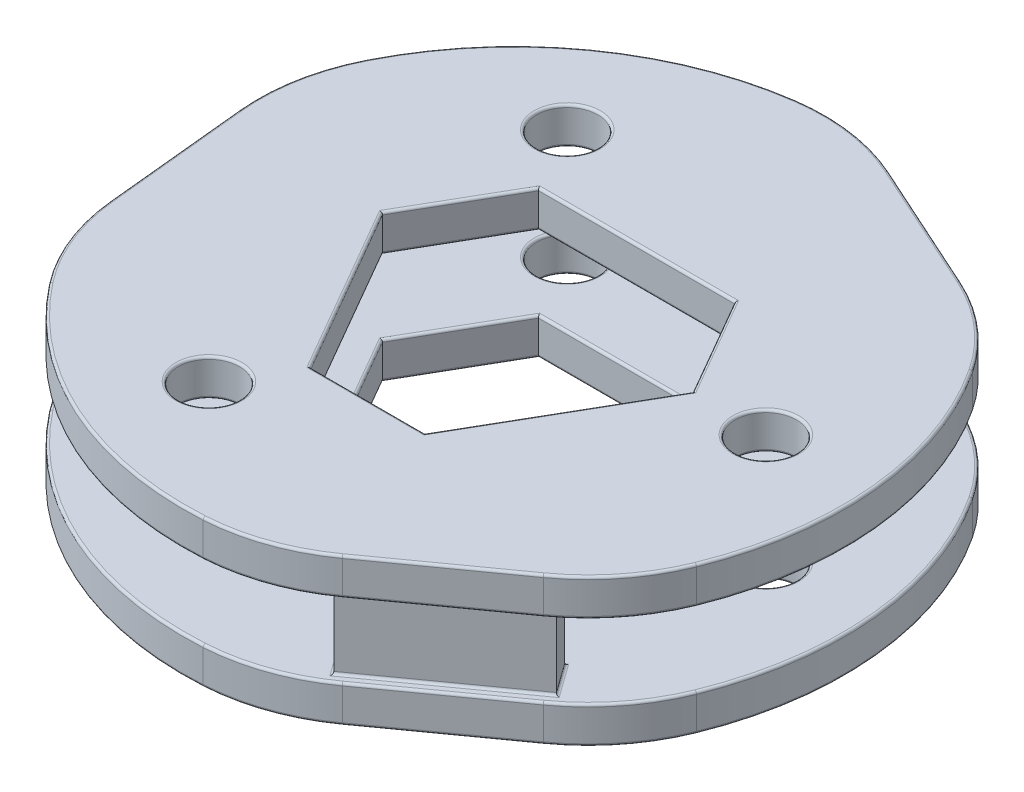
from build123d import *

# Parameters (mm, degrees)
SKETCH1_W                = 135
SKETCH1_H                = 15
SKETCH2_R                = 12.5
BOSS_EXTRUDE1_DEPTH      = 30
CIRPATTERN1_COUNT        = 3
CUT_EXTRUDE1_DEPTH       = 201.124960962
BOSS_EXTRUDE2_DEPTH      = 45
CUT_EXTRUDE2_DEPTH       = 201.124960962
FILLET1_R                = 80
CIRPATTERN2_COUNT        = 3
FILLET1_OF_CIRPATTERN2_R = 80
SPLIT2_START             = 15
SPLIT2_DEPTH             = 30
SPLIT2_2_DEPTH           = 30
SPLIT2_3_DEPTH           = 30
SPLIT2_4_OUTLINE_R       = 12.5
SPLIT2_4_DEPTH           = 30
SPLIT2_5_OUTLINE_R       = 12.5
SPLIT2_5_DEPTH           = 30
SPLIT2_6_OUTLINE_R       = 12.5
SPLIT2_6_DEPTH           = 30
SPLIT2_7_OUTLINE_R       = 12.5
SPLIT2_7_DEPTH           = 30
SKETCH8_R                = 12.5
CUT_EXTRUDE3_DEPTH       = 201.124960962
CIRPATTERN3_COUNT        = 3
FILLET3_R                = 1


# Read off the part's stored shape, not the designer's step: Split1, Split2
with BuildPart() as part:
    # Sketch1 → Revolve1 (revolve)
    with BuildSketch(Plane.XY, mode=Mode.PRIVATE) as revolve1_sk:
        with Locations((67.5, 7.5)):
            Rectangle(SKETCH1_W, SKETCH1_H)
    revolve1 = revolve(revolve1_sk.sketch.rotate(Axis((0, 15, 0), (0, -1, 0)), 90), axis=Axis((0, 15, 0), (0, -1, 0)))

    # Sketch2 → Boss-Extrude1 (add)
    with BuildSketch(Plane(origin=(0, 15, 0), x_dir=(1, 0, 0), z_dir=(0, 1, 0))):
        with Locations(Location((94, 9.213459812, 0), (0, 0, 90))):
            Circle(SKETCH2_R)
    boss_extrude1 = extrude(amount=BOSS_EXTRUDE1_DEPTH)

    # CirPattern1: Boss-Extrude1 ×3 about axis
    cirpattern1_axis = Axis((0, 0, 0), (0, 1, 0))
    for i in range(1, CIRPATTERN1_COUNT):
        add(boss_extrude1.rotate(cirpattern1_axis, i * 360 / CIRPATTERN1_COUNT))

    # Mirror1: Revolve1 across plane
    add(revolve1.mirror(Plane.ZX.offset(30)))

    # Sketch3 → Cut-Extrude1 (cut, through all)
    with BuildSketch(Plane(origin=(0, 60, 0), x_dir=(1, 0, 0), z_dir=(0, 1, 0))):
        Polygon((-40, 50), (40, 50), (63.301270189, 9.641016151), (23.301270189, -59.641016151), (-23.301270189, -59.641016151), (-63.301270189, 9.641016151), align=None)
    extrude(amount=-CUT_EXTRUDE1_DEPTH, mode=Mode.SUBTRACT)

    # Sketch4 → Boss-Extrude2 (add)
    with BuildSketch(Plane(origin=(0, 60, 0), x_dir=(1, 0, 0), z_dir=(0, 1, 0))):
        Polygon((-110.1811428, 21.739727949), (-125.108017737, 20.260402217), (-118.697606231, -44.422722509), (-103.770731294, -42.943396777), align=None)
    boss_extrude2 = extrude(amount=-BOSS_EXTRUDE2_DEPTH)

    # Sketch5 → Cut-Extrude2 (cut, through all)
    with BuildSketch(Plane(origin=(0, 60, 0), x_dir=(1, 0, 0), z_dir=(0, 1, 0))):
        Polygon((-131.511500416, 44.31459416), (-119.441522169, -77.475388847), (-152.060350872, -80.524763143), (-164.112338914, 41.083692884), align=None)
    cut_extrude2 = extrude(amount=-CUT_EXTRUDE2_DEPTH, mode=Mode.SUBTRACT)

    # Fillet1
    fillet1_edges = [part.edges().sort_by_distance(p)[0] for p in [
        (-130.532936264, 7.5, -34.440565477),
        (-121.23368767, 7.5, 59.391859492),
        (-121.23368767, 52.5, 59.391859492),
        (-130.532936264, 52.5, -34.440565477),
    ]]
    fillet(fillet1_edges, radius=FILLET1_R)

    # CirPattern2: Boss-Extrude2, Cut-Extrude2 ×3 about axis
    cirpattern2_axis = Axis((0, 0, 0), (0, 1, 0))
    add([boss_extrude2.rotate(cirpattern2_axis, i * 360 / CIRPATTERN2_COUNT) for i in range(1, CIRPATTERN2_COUNT)])
    add([cut_extrude2.rotate(cirpattern2_axis, i * 360 / CIRPATTERN2_COUNT) for i in range(1, CIRPATTERN2_COUNT)], mode=Mode.SUBTRACT)

    # Fillet1 of CirPattern2
    fillet1_of_cirpattern2_edges = [part.edges().sort_by_distance(p)[0] for p in [
        (35.440063508, 7.5, 130.265121573),
        (112.051702933, 7.5, 75.29552357),
        (112.051702933, 52.5, 75.29552357),
        (35.440063508, 52.5, 130.265121573),
        (95.092872755, 7.5, -95.824556097),
        (9.181984737, 7.5, -134.687383063),
        (9.181984737, 52.5, -134.687383063),
        (95.092872755, 52.5, -95.824556097),
    ]]
    fillet(fillet1_of_cirpattern2_edges, radius=FILLET1_OF_CIRPATTERN2_R)


with BuildPart() as body_2:
    # Split1: the piece on the far side of the plane
    add(part.part)
    split(bisect_by=Plane(origin=(0, 15, 0), x_dir=(1, 0, 0), z_dir=(0, 1, 0)), keep=Keep.BOTTOM)


with BuildPart() as part_1:
    add(part.part)

    # Split1
    split(bisect_by=Plane(origin=(0, 15, 0), x_dir=(1, 0, 0), z_dir=(0, 1, 0)), keep=Keep.TOP)

    # Split2 4 outline → Split2 4 (cut)
    with BuildSketch(Plane(origin=(0, 0, 0), x_dir=(1, 0, 0), z_dir=(0, 1, 0)).offset(SPLIT2_START)):
        with Locations((94, 9.213459812)):
            Circle(SPLIT2_4_OUTLINE_R)
        with Locations((-54.979090254, 76.79965805)):
            Circle(SPLIT2_4_OUTLINE_R)
        with Locations((-39.020909746, -86.013117862)):
            Circle(SPLIT2_4_OUTLINE_R)
        Polygon((-110.1811428, 21.739727949), (-125.108017737, 20.260402217), (-118.697606231, -44.422722509), (-103.770731294, -42.943396777), align=None)
        Polygon((73.917728075, 84.549804708), (80.100031879, 98.216520469), (20.877596917, 125.006503619), (14.695293113, 111.339787858), align=None)
        Polygon((36.263414725, -106.289532657), (45.007985857, -118.476922686), (97.820009313, -80.58378111), (89.07543818, -68.396391081), align=None)
    extrude(amount=SPLIT2_4_DEPTH, mode=Mode.SUBTRACT)


with BuildPart() as body_3:
    # Split2 outline → Split2 (new body)
    with BuildSketch(Plane(origin=(0, 0, 0), x_dir=(1, 0, 0), z_dir=(0, 1, 0)).offset(SPLIT2_START)):
        Polygon((20.877596917, 125.006503619), (14.695293113, 111.339787858), (73.917728075, 84.549804708), (80.100031879, 98.216520469), align=None)
    extrude(amount=SPLIT2_DEPTH)


with BuildPart() as body_4:
    # Split2 2 outline → Split2 2 (new body)
    with BuildSketch(Plane(origin=(0, 0, 0), x_dir=(1, 0, 0), z_dir=(0, 1, 0)).offset(SPLIT2_START)):
        Polygon((-118.697606231, -44.422722509), (-103.770731294, -42.943396777), (-110.1811428, 21.739727949), (-125.108017737, 20.260402217), align=None)
    extrude(amount=SPLIT2_2_DEPTH)


with BuildPart() as body_5:
    # Split2 3 outline → Split2 3 (new body)
    with BuildSketch(Plane(origin=(0, 0, 0), x_dir=(1, 0, 0), z_dir=(0, 1, 0)).offset(SPLIT2_START)):
        Polygon((97.820009313, -80.58378111), (89.07543818, -68.396391081), (36.263414725, -106.289532657), (45.007985857, -118.476922686), align=None)
    extrude(amount=SPLIT2_3_DEPTH)


with BuildPart() as body_6:
    # Split2 5 outline → Split2 5 (new body)
    with BuildSketch(Plane(origin=(0, 0, 0), x_dir=(1, 0, 0), z_dir=(0, 1, 0)).offset(SPLIT2_START)):
        with Locations((94, 9.213459812)):
            Circle(SPLIT2_5_OUTLINE_R)
    extrude(amount=SPLIT2_5_DEPTH)


with BuildPart() as body_7:
    # Split2 6 outline → Split2 6 (new body)
    with BuildSketch(Plane(origin=(0, 0, 0), x_dir=(1, 0, 0), z_dir=(0, 1, 0)).offset(SPLIT2_START)):
        with Locations((-54.979090254, 76.79965805)):
            Circle(SPLIT2_6_OUTLINE_R)
    extrude(amount=SPLIT2_6_DEPTH)


with BuildPart() as body_8:
    # Split2 7 outline → Split2 7 (new body)
    with BuildSketch(Plane(origin=(0, 0, 0), x_dir=(1, 0, 0), z_dir=(0, 1, 0)).offset(SPLIT2_START)):
        with Locations((-39.020909746, -86.013117862)):
            Circle(SPLIT2_7_OUTLINE_R)
    extrude(amount=SPLIT2_7_DEPTH)


with BuildPart() as part_2:
    add(part_1.part)

    # Combine1: union body 5, body 2, body 4, body 3
    add(body_5.part)
    add(body_2.part)
    add(body_4.part)
    add(body_3.part)

    # Sketch8 → Cut-Extrude3 (cut, through all)
    with BuildSketch(Plane(origin=(0, 60, 0), x_dir=(1, 0, 0), z_dir=(0, 1, 0))):
        with Locations(Location((93.551375598, 9.172792577, 0), (0, 0, 270))):
            Circle(SKETCH8_R)
    cut_extrude3 = extrude(amount=-CUT_EXTRUDE3_DEPTH, mode=Mode.SUBTRACT)

    # CirPattern3: Cut-Extrude3 ×3 about axis
    cirpattern3_axis = Axis((0, 0, 0), (0, 1, 0))
    for i in range(1, CIRPATTERN3_COUNT):
        add(cut_extrude3.rotate(cirpattern3_axis, i * 360 / CIRPATTERN3_COUNT), mode=Mode.SUBTRACT)

    # Fillet3
    fillet3_edges = [part_2.edges().sort_by_distance(p)[0] for p in [
        (29.974202014, 45, 130.306225106),
        (93.551375598, 15, -21.672792577),
        (93.551375598, 45, -21.672792577),
        (93.551375598, 0, -21.672792577),
        (93.551375598, 60, -21.672792577),
        (29.974202014, 60, 130.306225106),
        (73.745883221, 45, 102.780322572),
        (73.745883221, 60, 102.780322572),
        (-65.544876742, 45, -70.181471538),
        (-65.544876742, 60, -70.181471538),
        (113.841294656, 60, 70.130768703),
        (-28.006498856, 45, 91.854264116),
        (-28.006498856, 60, 91.854264116),
        (113.841294656, 45, 70.130768703),
        (97.861400206, 45, -91.111532955),
        (-65.544876742, 15, -70.181471538),
        (-65.544876742, 0, -70.181471538),
        (-28.006498856, 15, 91.854264116),
        (-28.006498856, 0, 91.854264116),
        (97.861400206, 60, -91.111532955),
        (52.137428746, 45, -115.25596958),
        (52.137428746, 60, -115.25596958),
        (3.814379956, 60, -133.654837523),
        (3.814379956, 45, -133.654837523),
        (-125.883311967, 45, 12.475647008),
        (-51.650635095, 60, -29.820508076),
        (-43.301270189, 60, 25),
        (0, 60, 59.641016151),
        (43.301270189, 60, 25),
        (51.650635095, 60, -29.820508076),
        (0, 60, -50),
        (-43.301270189, 45, 25),
        (0, 45, 59.641016151),
        (43.301270189, 45, 25),
        (51.650635095, 45, -29.820508076),
        (0, 45, -50),
        (-51.650635095, 45, -29.820508076),
        (-78.701140196, 60, -109.686510255),
        (134.341874431, 60, -13.313931589),
        (-55.640734235, 60, 123.000441844),
        (-78.701140196, 45, -109.686510255),
        (134.341874431, 45, -13.313931589),
        (-55.640734235, 45, 123.000441844),
        (-125.883311967, 60, 12.475647008),
        (-127.83560222, 45, -39.194692151),
        (-117.655674611, 45, 63.52406882),
        (-127.83560222, 60, -39.194692151),
        (-117.655674611, 60, 63.52406882),
        (71.413997585, 45, 99.530351898),
        (40.635700291, 45, 112.383227671),
        (93.447723747, 45, 74.490086096),
        (71.413997585, 15, 99.530351898),
        (62.669426453, 45, 87.342961869),
        (40.635700291, 15, 112.383227671),
        (44.306510594, 15, -97.944796283),
        (17.786445015, 15, -118.173145738),
        (3.814379956, 15, -133.654837523),
        (-78.701140196, 15, -109.686510255),
        (-127.83560222, 15, -39.194692151),
        (-125.883311967, 15, 12.475647008),
        (-117.655674611, 15, 63.52406882),
        (-55.640734235, 15, 123.000441844),
        (29.974202014, 15, 130.306225106),
        (73.745883221, 15, 102.780322572),
        (113.841294656, 15, 70.130768703),
        (134.341874431, 15, -13.313931589),
        (97.861400206, 15, -91.111532955),
        (52.137428746, 15, -115.25596958),
        (-43.301270189, 15, 25),
        (-51.650635095, 15, -29.820508076),
        (0, 15, -50),
        (51.650635095, 15, -29.820508076),
        (43.301270189, 15, 25),
        (0, 15, 59.641016151),
        (-106.975937047, 15, 10.601834414),
        (-111.234168762, 15, 43.683059643),
        (93.447723747, 15, 74.490086096),
        (62.669426453, 15, 87.342961869),
        (-55.640734235, 0, 123.000441844),
        (-78.701140196, 0, -109.686510255),
        (134.341874431, 0, -13.313931589),
        (0, 0, -50),
        (-51.650635095, 0, -29.820508076),
        (-43.301270189, 0, 25),
        (0, 0, 59.641016151),
        (43.301270189, 0, 25),
        (51.650635095, 0, -29.820508076),
        (3.814379956, 0, -133.654837523),
        (52.137428746, 0, -115.25596958),
        (97.861400206, 0, -91.111532955),
        (113.841294656, 0, 70.130768703),
        (73.745883221, 0, 102.780322572),
        (29.974202014, 0, 130.306225106),
        (-117.655674611, 0, 63.52406882),
        (-125.883311967, 0, 12.475647008),
        (-127.83560222, 0, -39.194692151),
        (-121.902811984, 45, 12.081160146),
        (-117.644580268, 45, -21.000065083),
        (-111.234168762, 45, 43.683059643),
        (-121.902811984, 15, 12.081160146),
        (-106.975937047, 45, 10.601834414),
        (-117.644580268, 15, -21.000065083),
        (50.488814398, 45, -111.611512044),
        (77.008879977, 45, -91.383162588),
        (17.786445015, 45, -118.173145738),
        (50.488814398, 15, -111.611512044),
        (44.306510594, 45, -97.944796283),
        (77.008879977, 15, -91.383162588),
    ]]
    fillet(fillet3_edges, radius=FILLET3_R)


solid = part_2.part
